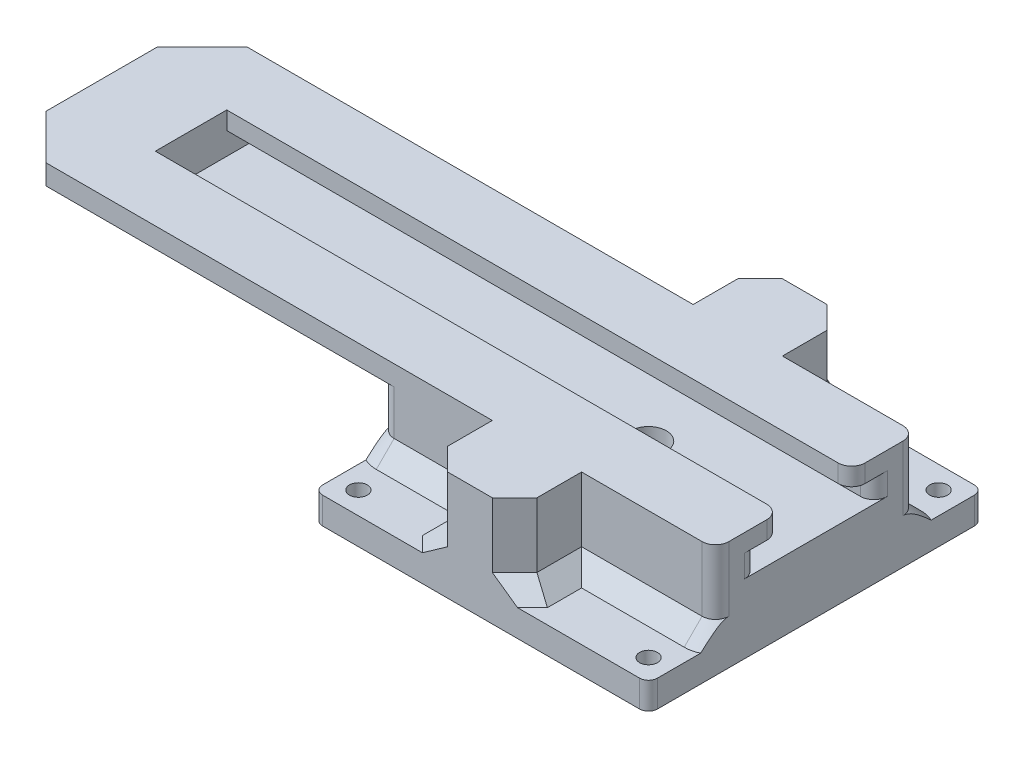
from build123d import *

# Parameters (mm, degrees)
BOSS_EXTRUDE1_DEPTH = 4
BOSS_EXTRUDE2_DEPTH = 5
BOSS_EXTRUDE3_START = -5
SKETCH3_W           = 160
SKETCH3_H           = 75
BOSS_EXTRUDE3_DEPTH = 5.5
BOSS_EXTRUDE4_START = -10.5
BOSS_EXTRUDE4_DEPTH = 10
BOSS_EXTRUDE7_START = -20.5
SKETCH17_R          = 15
BOSS_EXTRUDE7_DEPTH = 8
CUT_EXTRUDE1_START  = -28.5
SKETCH5_R           = 10.5
CUT_EXTRUDE1_DEPTH  = 3
CUT_EXTRUDE2_START  = -4
SKETCH7_R           = 2
CUT_EXTRUDE2_DEPTH  = 25
CUT_EXTRUDE3_START  = -5
SKETCH8_R           = 4
CUT_EXTRUDE3_DEPTH  = 18.5
CUT_EXTRUDE5_START  = 4
SKETCH18_W          = 110
SKETCH18_H          = 15
SKETCH18_W_2        = 30
CUT_EXTRUDE5_DEPTH  = 18.5
CUT_EXTRUDE6_START  = -4
SKETCH9_R           = 2
CUT_EXTRUDE6_DEPTH  = 40
CHAMFER1_SIZE       = 10
FILLET1_R           = 2
CHAMFER2_SIZE       = 5
FILLET6_R           = 3
CHAMFER4_SIZE       = 4


with BuildPart() as part:
    # Sketch1 → Boss-Extrude1 (new body)
    with BuildSketch(Plane(origin=(0, 0, 0), x_dir=(1, 0, 0), z_dir=(0, 1, 0))):
        Polygon((80, -16), (220, -16), (220, -45.5), (60, -45.5), (60, 29.5), (220, 29.5), (220, 0), (80, 0), align=None)
    extrude(amount=BOSS_EXTRUDE1_DEPTH)

    # Sketch2 → Boss-Extrude2 (add)
    with BuildSketch(Plane(origin=(0, 0, 0), x_dir=(1, 0, 0), z_dir=(0, 1, 0))):
        Polygon((220, 5), (220, 29.5), (60, 29.5), (60, -45.5), (220, -45.5), (220, -21), (80, -21), (80, 5), align=None)
    extrude(amount=-BOSS_EXTRUDE2_DEPTH)

    # Sketch3 → Boss-Extrude3 (add)
    with BuildSketch(Plane(origin=(0, 0, 0), x_dir=(1, 0, 0), z_dir=(0, 1, 0)).offset(BOSS_EXTRUDE3_START)):
        with Locations((140, -8)):
            Rectangle(SKETCH3_W, SKETCH3_H)
    extrude(amount=-BOSS_EXTRUDE3_DEPTH)

    # Sketch4 → Boss-Extrude4 (add)
    with BuildSketch(Plane(origin=(0, 0, 0), x_dir=(1, 0, 0), z_dir=(0, 1, 0)).offset(BOSS_EXTRUDE4_START)):
        Polygon((145, -8), (145, -45.5), (220, -45.5), (220, 29.5), (145, 29.5), align=None)
    extrude(amount=-BOSS_EXTRUDE4_DEPTH)

    # Sketch17 → Boss-Extrude7 (add)
    with BuildSketch(Plane(origin=(0, 0, 0), x_dir=(1, 0, 0), z_dir=(0, 1, 0)).offset(BOSS_EXTRUDE7_START)):
        with Locations(Location((182.5, -8, 0), (0, 0, 270))):
            Circle(SKETCH17_R)
    extrude(amount=-BOSS_EXTRUDE7_DEPTH)

    # Sketch5 → Cut-Extrude1 (cut)
    with BuildSketch(Plane(origin=(0, 0, 0), x_dir=(1, 0, 0), z_dir=(0, 1, 0)).offset(CUT_EXTRUDE1_START)):
        with Locations(Location((182.5, -8, 0), (0, 0, 270))):
            Circle(SKETCH5_R)
    extrude(amount=CUT_EXTRUDE1_DEPTH, mode=Mode.SUBTRACT)

    # Sketch7 → Cut-Extrude2 (cut)
    with BuildSketch(Plane(origin=(0, 0, 0), x_dir=(1, 0, 0), z_dir=(0, 1, 0)).offset(CUT_EXTRUDE2_START)):
        with Locations(Location((182.5, -8, 0), (0, 0, 270))):
            Circle(SKETCH7_R)
    extrude(amount=-CUT_EXTRUDE2_DEPTH, mode=Mode.SUBTRACT)

    # Sketch8 → Cut-Extrude3 (cut)
    with BuildSketch(Plane(origin=(0, 0, 0), x_dir=(1, 0, 0), z_dir=(0, 1, 0)).offset(CUT_EXTRUDE3_START)):
        with Locations(Location((182.5, -8, 0), (0, 0, 270))):
            Circle(SKETCH8_R)
    extrude(amount=-CUT_EXTRUDE3_DEPTH, mode=Mode.SUBTRACT)

    # Sketch18 → Cut-Extrude5 (cut)
    with BuildSketch(Plane(origin=(0, 0, 0), x_dir=(1, 0, 0), z_dir=(0, 1, 0)).offset(CUT_EXTRUDE5_START)):
        with Locations((115, 22)):
            Rectangle(SKETCH18_W, SKETCH18_H)
        with Locations((115, -38)):
            Rectangle(SKETCH18_W, SKETCH18_H)
        with Locations((205, 22)):
            Rectangle(SKETCH18_W_2, SKETCH18_H)
        with Locations((205, -38)):
            Rectangle(SKETCH18_W_2, SKETCH18_H)
    extrude(amount=-CUT_EXTRUDE5_DEPTH, mode=Mode.SUBTRACT)

    # Sketch9 → Cut-Extrude6 (cut)
    with BuildSketch(Plane(origin=(0, 0, 0), x_dir=(1, 0, 0), z_dir=(0, 1, 0)).offset(CUT_EXTRUDE6_START)):
        with Locations(Location((150, -40.5, 0), (0, 0, 270))):
            Circle(SKETCH9_R)
        with Locations(Location((150, 24.5, 0), (0, 0, 270))):
            Circle(SKETCH9_R)
        with Locations(Location((215, 24.5, 0), (0, 0, 270))):
            Circle(SKETCH9_R)
        with Locations(Location((215, -40.5, 0), (0, 0, 270))):
            Circle(SKETCH9_R)
    extrude(amount=-CUT_EXTRUDE6_DEPTH, mode=Mode.SUBTRACT)

    # Chamfer1
    chamfer1_edges = [part.edges().sort_by_distance(p)[0] for p in [
        (60, -10.5, 8),
        (102.5, -10.5, 30.5),
        (60, -3.25, 30.5),
        (102.5, -10.5, -14.5),
        (60, -3.25, -14.5),
    ]]
    chamfer(chamfer1_edges, length=CHAMFER1_SIZE)

    # Fillet1
    fillet1_edges = [part.edges().sort_by_distance(p)[0] for p in [
        (220, -17.5, 45.5),
        (220, -17.5, -29.5),
        (145, -17.5, 45.5),
        (145, -17.5, -29.5),
    ]]
    fillet(fillet1_edges, radius=FILLET1_R)

    # Chamfer2
    chamfer2_edges = [part.edges().sort_by_distance(p)[0] for p in [
        (170, -5.25, 45.5),
        (190, -5.25, -29.5),
        (190, -5.25, 45.5),
        (170, -5.25, -29.5),
    ]]
    chamfer(chamfer2_edges, length=CHAMFER2_SIZE)

    # Fillet6
    fillet6_edges = [part.edges().sort_by_distance(p)[0] for p in [
        (220, -5.25, -14.5),
        (220, -5.25, 30.5),
        (220, 2, 16),
        (220, 2, 0),
        (220, -2.5, -5),
        (220, -2.5, 21),
        (145, -7.5, -14.5),
        (145, -7.5, 30.5),
    ]]
    fillet(fillet6_edges, radius=FILLET6_R)

    # Chamfer4
    # the kernel refuses this chamfer: 4 mm, written as the material it adds along each edge
    with BuildSketch(Plane(origin=(180.286731952, -14.5, 30.5), x_dir=(0, 1, 0), z_dir=(-1, 0, 0)), Plane(origin=(180.286731952, -14.5, -14.5), x_dir=(0, 0, -1), z_dir=(-1, 0, 0))) as chamfer4_piece_1:
        Polygon((CHAMFER4_SIZE, 0), (0, -CHAMFER4_SIZE), (0, 0), align=None)
    extrude(amount=32.286731952)
    with BuildSketch(Plane(origin=(217, -14.5, -14.5), x_dir=(0, 0, -1), z_dir=(-1, 0, 0)), Plane(origin=(217, -14.5, 30.5), x_dir=(0, 1, 0), z_dir=(-1, 0, 0))) as chamfer4_piece_2:
        Polygon((CHAMFER4_SIZE, 0), (0, -CHAMFER4_SIZE), (0, 0), align=None)
    extrude(amount=37.286731952)
    with BuildSketch(Plane(origin=(190, -14.5, 20.213268048), x_dir=(1, 0, 0), z_dir=(0, 0, 1))) as chamfer4_piece_3_section:
        Polygon((CHAMFER4_SIZE, 0), (0, CHAMFER4_SIZE), (0, 0), align=None)
    chamfer4_piece_3 = extrude(amount=30.573463904, mode=Mode.PRIVATE)
    chamfer4_piece_3 = split(chamfer4_piece_3, bisect_by=Plane(origin=(200.143365976, -14.5, 30.356634024), z_dir=(-0.7071067811865476, 0, -0.7071067811865476)), keep=Keep.TOP, mode=Mode.PRIVATE)
    add(chamfer4_piece_3)
    with BuildSketch(Plane(origin=(170, -14.5, -34.786731952), x_dir=(-1, 0, 0), z_dir=(0, 0, 1))) as chamfer4_piece_4_section:
        Polygon((CHAMFER4_SIZE, 0), (0, -CHAMFER4_SIZE), (0, 0), align=None)
    chamfer4_piece_4 = extrude(amount=30.573463904, mode=Mode.PRIVATE)
    chamfer4_piece_4 = split(chamfer4_piece_4, bisect_by=Plane(origin=(175.143365976, -14.5, -29.643365976), z_dir=(0.7071067811865476, 0, 0.7071067811865476)), keep=Keep.TOP, mode=Mode.PRIVATE)
    add(chamfer4_piece_4)
    with BuildSketch(Plane(origin=(170, -14.5, 50.786731952), x_dir=(0, 1, 0), z_dir=(0, 0, -1))) as chamfer4_piece_5_section:
        Polygon((CHAMFER4_SIZE, 0), (0, -CHAMFER4_SIZE), (0, 0), align=None)
    chamfer4_piece_5 = extrude(amount=30.573463904, mode=Mode.PRIVATE)
    chamfer4_piece_5 = split(chamfer4_piece_5, bisect_by=Plane(origin=(175.143365976, -14.5, 45.643365976), z_dir=(0.7071067811865476, 0, -0.7071067811865476)), keep=Keep.TOP, mode=Mode.PRIVATE)
    add(chamfer4_piece_5)
    with BuildSketch(Plane(origin=(190, -14.5, -4.213268048), x_dir=(1, 0, 0), z_dir=(0, 0, -1))) as chamfer4_piece_6_section:
        Polygon((CHAMFER4_SIZE, 0), (0, -CHAMFER4_SIZE), (0, 0), align=None)
    chamfer4_piece_6 = extrude(amount=30.573463904, mode=Mode.PRIVATE)
    chamfer4_piece_6 = split(chamfer4_piece_6, bisect_by=Plane(origin=(200.143365976, -14.5, -14.356634024), z_dir=(-0.7071067811865476, 0, 0.7071067811865476)), keep=Keep.TOP, mode=Mode.PRIVATE)
    add(chamfer4_piece_6)
    with BuildSketch(Plane(origin=(177.726182081, -14.5, 52.773817919), x_dir=(0.7071067811865476, 0, 0.7071067811865476), z_dir=(0.7071067811865476, 0, -0.7071067811865476))) as chamfer4_piece_7_section:
        Polygon((CHAMFER4_SIZE, 0), (0, -CHAMFER4_SIZE), (0, 0), align=None)
    chamfer4_piece_7 = extrude(amount=27.644531716, mode=Mode.PRIVATE)
    chamfer4_piece_7 = split(chamfer4_piece_7, bisect_by=Plane(origin=(177.726182081, -14.5, 45.5), z_dir=(0, 0, -1)), keep=Keep.TOP, mode=Mode.PRIVATE)
    chamfer4_piece_7 = split(chamfer4_piece_7, bisect_by=Plane(origin=(190, -14.5, 52.773817919), z_dir=(-1, 0, 0)), keep=Keep.TOP, mode=Mode.PRIVATE)
    add(chamfer4_piece_7)
    with BuildSketch(Plane(origin=(182.273817919, -14.5, 52.773817919), x_dir=(0, 1, 0), z_dir=(-0.7071067811865476, 0, -0.7071067811865476))) as chamfer4_piece_8_section:
        Polygon((CHAMFER4_SIZE, 0), (0, -CHAMFER4_SIZE), (0, 0), align=None)
    chamfer4_piece_8 = extrude(amount=27.644531716, mode=Mode.PRIVATE)
    chamfer4_piece_8 = split(chamfer4_piece_8, bisect_by=Plane(origin=(170, -14.5, 52.773817919), z_dir=(1, 0, 0)), keep=Keep.TOP, mode=Mode.PRIVATE)
    chamfer4_piece_8 = split(chamfer4_piece_8, bisect_by=Plane(origin=(182.273817919, -14.5, 45.5), z_dir=(0, 0, -1)), keep=Keep.TOP, mode=Mode.PRIVATE)
    add(chamfer4_piece_8)
    with BuildSketch(Plane(origin=(182.273817919, -14.5, -36.773817919), x_dir=(-0.7071067811865476, 0, -0.7071067811865476), z_dir=(-0.7071067811865476, 0, 0.7071067811865476))) as chamfer4_piece_9_section:
        Polygon((CHAMFER4_SIZE, 0), (0, -CHAMFER4_SIZE), (0, 0), align=None)
    chamfer4_piece_9 = extrude(amount=27.644531716, mode=Mode.PRIVATE)
    chamfer4_piece_9 = split(chamfer4_piece_9, bisect_by=Plane(origin=(170, -14.5, -36.773817919), z_dir=(1, 0, 0)), keep=Keep.TOP, mode=Mode.PRIVATE)
    chamfer4_piece_9 = split(chamfer4_piece_9, bisect_by=Plane(origin=(182.273817919, -14.5, -29.5), z_dir=(0, 0, 1)), keep=Keep.TOP, mode=Mode.PRIVATE)
    add(chamfer4_piece_9)
    with BuildSketch(Plane(origin=(177.726182081, -14.5, -36.773817919), x_dir=(0.7071067811865476, 0, -0.7071067811865476), z_dir=(0.7071067811865476, 0, 0.7071067811865476))) as chamfer4_piece_10_section:
        Polygon((CHAMFER4_SIZE, 0), (0, CHAMFER4_SIZE), (0, 0), align=None)
    chamfer4_piece_10 = extrude(amount=27.644531716, mode=Mode.PRIVATE)
    chamfer4_piece_10 = split(chamfer4_piece_10, bisect_by=Plane(origin=(190, -14.5, -36.773817919), z_dir=(-1, 0, 0)), keep=Keep.TOP, mode=Mode.PRIVATE)
    chamfer4_piece_10 = split(chamfer4_piece_10, bisect_by=Plane(origin=(177.726182081, -14.5, -29.5), z_dir=(0, 0, 1)), keep=Keep.TOP, mode=Mode.PRIVATE)
    add(chamfer4_piece_10)
    with BuildSketch(Plane(origin=(148, -14.5, -11.5), x_dir=(0, 0, -1), z_dir=(1, 0, 0))) as chamfer4_piece_11_section:
        Polygon((3 + CHAMFER4_SIZE, 0), (3, CHAMFER4_SIZE), (3, 0), align=None)
    chamfer4_piece_11 = revolve(axis=Axis((148, -14.5, -11.5), (0, 1, 0)), revolution_arc=286.541029039, mode=Mode.PRIVATE)
    chamfer4_piece_11 = split(chamfer4_piece_11, bisect_by=Plane(origin=(145, -14.5, -11.5), z_dir=(1, 0, 0)), keep=Keep.TOP, mode=Mode.PRIVATE)
    add(chamfer4_piece_11)
    with BuildSketch(Plane(origin=(148, -14.5, 27.5), x_dir=(0, 0, 1), z_dir=(1, 0, 0))) as chamfer4_piece_12_section:
        Polygon((3, -CHAMFER4_SIZE), (3 + CHAMFER4_SIZE, 0), (3, 0), align=None)
    chamfer4_piece_12 = revolve(axis=Axis((148, -14.5, 27.5), (0, -1, 0)), revolution_arc=286.541029039, mode=Mode.PRIVATE)
    chamfer4_piece_12 = split(chamfer4_piece_12, bisect_by=Plane(origin=(145, -14.5, 27.5), z_dir=(1, 0, 0)), keep=Keep.TOP, mode=Mode.PRIVATE)
    add(chamfer4_piece_12)
    with BuildSketch(Plane(origin=(217, -14.5, 27.5), x_dir=(0, 0, 1), z_dir=(-1, 0, 0))) as chamfer4_piece_13_section:
        Polygon((3 + CHAMFER4_SIZE, 0), (3, CHAMFER4_SIZE), (3, 0), align=None)
    chamfer4_piece_13 = revolve(axis=Axis((217, -14.5, 27.5), (0, 1, 0)), revolution_arc=286.541029039, mode=Mode.PRIVATE)
    chamfer4_piece_13 = split(chamfer4_piece_13, bisect_by=Plane(origin=(220, -14.5, 27.5), z_dir=(-1, 0, 0)), keep=Keep.TOP, mode=Mode.PRIVATE)
    add(chamfer4_piece_13)
    with BuildSketch(Plane(origin=(217, -14.5, -11.5), x_dir=(-0.9586161079841448, 0, -0.28470187479770964), z_dir=(0.28470187479770964, 0, -0.9586161079841448))) as chamfer4_piece_14_section:
        Polygon((3 + CHAMFER4_SIZE, 0), (3, CHAMFER4_SIZE), (3, 0), align=None)
    chamfer4_piece_14 = revolve(axis=Axis((217, -14.5, -11.5), (0, 1, 0)), revolution_arc=286.541029039, mode=Mode.PRIVATE)
    chamfer4_piece_14 = split(chamfer4_piece_14, bisect_by=Plane(origin=(220, -14.5, -11.5), z_dir=(-1, 0, 0)), keep=Keep.TOP, mode=Mode.PRIVATE)
    add(chamfer4_piece_14)
    with BuildSketch(Plane(origin=(190, -14.5, 30.5), x_dir=(1, 0, 0), z_dir=(0, 0, 1))) as chamfer4_piece_15a_section:
        Polygon((CHAMFER4_SIZE, 0), (0, CHAMFER4_SIZE), (0, 0), align=None)
    chamfer4_piece_15a = extrude(amount=20.286731952, mode=Mode.PRIVATE)
    chamfer4_piece_15a = split(chamfer4_piece_15a, bisect_by=Plane(origin=(190, -14.5, 45.5), z_dir=(0, 0, -1)), keep=Keep.TOP, mode=Mode.PRIVATE)
    chamfer4_piece_15a = split(chamfer4_piece_15a, bisect_by=Plane(origin=(195, -14.5, 35.5), z_dir=(0.7071067811865476, 0, 0.7071067811865476)), keep=Keep.TOP, mode=Mode.PRIVATE)
    with BuildSketch(Plane(origin=(177.726182081, -14.5, 52.773817919), x_dir=(0.7071067811865476, 0, 0.7071067811865476), z_dir=(0.7071067811865476, 0, -0.7071067811865476))) as chamfer4_piece_15b_section:
        Polygon((CHAMFER4_SIZE, 0), (0, -CHAMFER4_SIZE), (0, 0), align=None)
    chamfer4_piece_15b = extrude(amount=27.644531716, mode=Mode.PRIVATE)
    chamfer4_piece_15b = split(chamfer4_piece_15b, bisect_by=Plane(origin=(177.726182081, -14.5, 45.5), z_dir=(0, 0, -1)), keep=Keep.TOP, mode=Mode.PRIVATE)
    chamfer4_piece_15b = split(chamfer4_piece_15b, bisect_by=Plane(origin=(190, -14.5, 52.773817919), z_dir=(1, 0, 0)), keep=Keep.TOP, mode=Mode.PRIVATE)
    chamfer4_piece_15 = chamfer4_piece_15a & chamfer4_piece_15b
    add(chamfer4_piece_15)
    with BuildSketch(Plane(origin=(182.273817919, -14.5, -36.773817919), x_dir=(-0.7071067811865476, 0, -0.7071067811865476), z_dir=(-0.7071067811865476, 0, 0.7071067811865476))) as chamfer4_piece_16a_section:
        Polygon((CHAMFER4_SIZE, 0), (0, -CHAMFER4_SIZE), (0, 0), align=None)
    chamfer4_piece_16a = extrude(amount=27.644531716, mode=Mode.PRIVATE)
    chamfer4_piece_16a = split(chamfer4_piece_16a, bisect_by=Plane(origin=(170, -14.5, -36.773817919), z_dir=(-1, 0, 0)), keep=Keep.TOP, mode=Mode.PRIVATE)
    chamfer4_piece_16a = split(chamfer4_piece_16a, bisect_by=Plane(origin=(182.273817919, -14.5, -29.5), z_dir=(0, 0, 1)), keep=Keep.TOP, mode=Mode.PRIVATE)
    with BuildSketch(Plane(origin=(170, -14.5, -34.786731952), x_dir=(-1, 0, 0), z_dir=(0, 0, 1))) as chamfer4_piece_16b_section:
        Polygon((CHAMFER4_SIZE, 0), (0, -CHAMFER4_SIZE), (0, 0), align=None)
    chamfer4_piece_16b = extrude(amount=20.286731952, mode=Mode.PRIVATE)
    chamfer4_piece_16b = split(chamfer4_piece_16b, bisect_by=Plane(origin=(175.143365976, -14.5, -29.643365976), z_dir=(-0.7071067811865476, 0, -0.7071067811865476)), keep=Keep.TOP, mode=Mode.PRIVATE)
    chamfer4_piece_16b = split(chamfer4_piece_16b, bisect_by=Plane(origin=(170, -14.5, -29.5), z_dir=(0, 0, 1)), keep=Keep.TOP, mode=Mode.PRIVATE)
    chamfer4_piece_16 = chamfer4_piece_16a & chamfer4_piece_16b
    add(chamfer4_piece_16)
    with BuildSketch(Plane(origin=(170, -14.5, 50.786731952), x_dir=(0, 1, 0), z_dir=(0, 0, -1))) as chamfer4_piece_17a_section:
        Polygon((CHAMFER4_SIZE, 0), (0, -CHAMFER4_SIZE), (0, 0), align=None)
    chamfer4_piece_17a = extrude(amount=20.286731952, mode=Mode.PRIVATE)
    chamfer4_piece_17a = split(chamfer4_piece_17a, bisect_by=Plane(origin=(175.143365976, -14.5, 45.643365976), z_dir=(-0.7071067811865476, 0, 0.7071067811865476)), keep=Keep.TOP, mode=Mode.PRIVATE)
    chamfer4_piece_17a = split(chamfer4_piece_17a, bisect_by=Plane(origin=(170, -14.5, 45.5), z_dir=(0, 0, -1)), keep=Keep.TOP, mode=Mode.PRIVATE)
    with BuildSketch(Plane(origin=(182.273817919, -14.5, 52.773817919), x_dir=(0, 1, 0), z_dir=(-0.7071067811865476, 0, -0.7071067811865476))) as chamfer4_piece_17b_section:
        Polygon((CHAMFER4_SIZE, 0), (0, -CHAMFER4_SIZE), (0, 0), align=None)
    chamfer4_piece_17b = extrude(amount=27.644531716, mode=Mode.PRIVATE)
    chamfer4_piece_17b = split(chamfer4_piece_17b, bisect_by=Plane(origin=(170, -14.5, 52.773817919), z_dir=(-1, 0, 0)), keep=Keep.TOP, mode=Mode.PRIVATE)
    chamfer4_piece_17b = split(chamfer4_piece_17b, bisect_by=Plane(origin=(182.273817919, -14.5, 45.5), z_dir=(0, 0, -1)), keep=Keep.TOP, mode=Mode.PRIVATE)
    chamfer4_piece_17 = chamfer4_piece_17a & chamfer4_piece_17b
    add(chamfer4_piece_17)
    with BuildSketch(Plane(origin=(190, -14.5, -14.5), x_dir=(1, 0, 0), z_dir=(0, 0, -1))) as chamfer4_piece_18a_section:
        Polygon((CHAMFER4_SIZE, 0), (0, -CHAMFER4_SIZE), (0, 0), align=None)
    chamfer4_piece_18a = extrude(amount=20.286731952, mode=Mode.PRIVATE)
    chamfer4_piece_18a = split(chamfer4_piece_18a, bisect_by=Plane(origin=(195, -14.5, -19.5), z_dir=(0.7071067811865476, 0, -0.7071067811865476)), keep=Keep.TOP, mode=Mode.PRIVATE)
    chamfer4_piece_18a = split(chamfer4_piece_18a, bisect_by=Plane(origin=(190, -14.5, -29.5), z_dir=(0, 0, 1)), keep=Keep.TOP, mode=Mode.PRIVATE)
    with BuildSketch(Plane(origin=(177.726182081, -14.5, -36.773817919), x_dir=(0.7071067811865476, 0, -0.7071067811865476), z_dir=(0.7071067811865476, 0, 0.7071067811865476))) as chamfer4_piece_18b_section:
        Polygon((CHAMFER4_SIZE, 0), (0, CHAMFER4_SIZE), (0, 0), align=None)
    chamfer4_piece_18b = extrude(amount=27.644531716, mode=Mode.PRIVATE)
    chamfer4_piece_18b = split(chamfer4_piece_18b, bisect_by=Plane(origin=(190, -14.5, -36.773817919), z_dir=(1, 0, 0)), keep=Keep.TOP, mode=Mode.PRIVATE)
    chamfer4_piece_18b = split(chamfer4_piece_18b, bisect_by=Plane(origin=(177.726182081, -14.5, -29.5), z_dir=(0, 0, 1)), keep=Keep.TOP, mode=Mode.PRIVATE)
    chamfer4_piece_18 = chamfer4_piece_18a & chamfer4_piece_18b
    add(chamfer4_piece_18)


solid = part.part
